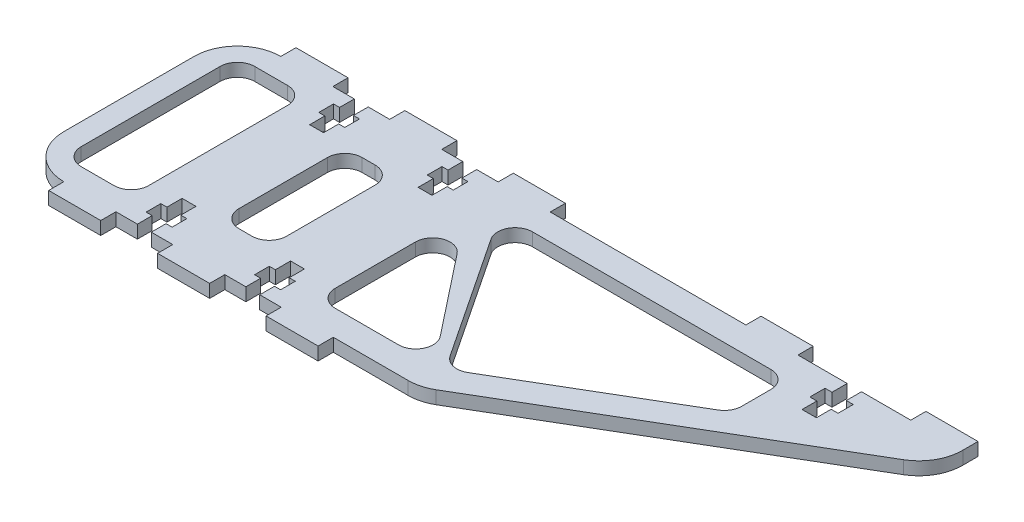
from build123d import *

# Parameters (mm, degrees)
EXTRUDE_1_DEPTH     = 3
FILLET_1_R          = 10
FILLET_2_R          = 10
SKETCH_2_W          = 11
SKETCH_2_H          = 28.4
SKETCH_2_W_2        = 15.55
SKETCH_2_H_2        = 40
CUT_EXTRUDE_1_DEPTH = 176.576963147
FILLET_3_R          = 4
EXTRUDE_START       = -3
EXTRUDE_2_DEPTH     = 3
FILLET_4_R          = 4


# Some blends are built 0.0001 mm under size
with BuildPart() as part:
    # 草图1 → 凸台-拉伸1 (new body)
    with BuildSketch(Plane(origin=(0, 0, 0), x_dir=(1, 0, 0), z_dir=(0, 1, 0))):
        Polygon((0, 0), (10, 0), (10, -3.5), (22, -3.5), (22, 0), (26.95, 0), (26.95, 3.4), (25.55, 3.4), (25.55, 6.8), (26.95, 6.8), (26.95, 10.3), (30.15, 10.3), (30.15, 6.8), (31.55, 6.8), (31.55, 3.4), (30.15, 3.4), (30.15, 0), (35.1, 0), (35.1, -3.5), (47.1, -3.5), (47.1, 0), (51.95, 0), (51.95, 3.4), (50.55, 3.4), (50.55, 6.8), (51.95, 6.8), (51.95, 10.3), (55.15, 10.3), (55.15, 6.8), (56.55, 6.8), (56.55, 3.4), (55.15, 3.4), (55.15, 0), (60.1, 0), (60.1, -3.5), (72.1, -3.5), (72.1, 0), (92.1, 0), (177.1, 50), (167.2, 50), (167.2, 53.5), (155.2, 53.5), (155.2, 50), (143.85, 50), (143.85, 46.5), (145.45, 46.5), (145.45, 43), (143.85, 43), (143.85, 39.6), (140.55, 39.6), (140.55, 43), (138.95, 43), (138.95, 46.5), (140.55, 46.5), (140.55, 50), (129.2, 50), (129.2, 53.5), (117.2, 53.5), (117.2, 50), (72.1, 50), (72.1, 53.5), (60.1, 53.5), (60.1, 50), (55.15, 50), (55.15, 46.6), (56.55, 46.6), (56.55, 43.2), (55.15, 43.2), (55.15, 39.7), (51.95, 39.7), (51.95, 43.2), (50.55, 43.2), (50.55, 46.6), (51.95, 46.6), (51.95, 50), (47.1, 50), (47.1, 53.5), (35.1, 53.5), (35.1, 50), (30.15, 50), (30.15, 46.6), (31.55, 46.6), (31.55, 43.2), (30.15, 43.2), (30.15, 39.7), (26.95, 39.7), (26.95, 43.2), (25.55, 43.2), (25.55, 46.6), (26.95, 46.6), (26.95, 50), (22, 50), (22, 53.5), (10, 53.5), (10, 50), (0, 50), align=None)
    extrude(amount=EXTRUDE_1_DEPTH)

    # 圆角1
    # the kernel refuses this fillet: 10 mm, written as the material it takes off along each edge
    with BuildSketch(Plane(origin=(177.1, -43.011578588, -50), x_dir=(-0.8619342151577696, 0, 0.5070201265633938), z_dir=(0, 1, 0))) as fillet_1_piece_1:
        with BuildLine():
            CenterArc((17.204631435, -10), FILLET_1_R, 90, 60.128922386)
            Line((8.53314873, -5.019499253), (8.359719076, -4.919889238))
            ThreePointArc((8.359719076, -4.919889238), (4.16517034, -2.68213647), (-0.101404025, -0.172386843))
            Line((-0.101404025, -0.172386843), (0, 0.2))
            Line((0, 0.2), (17.204631435, 0.2))
            Line((17.204631435, 0.2), (17.204631435, 0))
        make_face()
    extrude(amount=89.023157177, mode=Mode.SUBTRACT)

    # 圆角2
    fillet_2_edges = [part.edges().sort_by_distance(p)[0] for p in [
        (92.1, 1.5, 0),
        (0, 1.5, -50),
        (0, 1.5, 0),
    ]]
    fillet(fillet_2_edges, radius=FILLET_2_R - 0.0001)  # a hair under: the kernel refuses the full size

    # 草图2 → 切除-拉伸1 (cut, through all)
    with BuildSketch(Plane.XZ):
        Polygon((62.55, -6), (62.55, -44), (132.95, -44), (132.95, -30.990499855), (90.466150246, -6), align=None)
        with Locations((41.05, -25)):
            Rectangle(SKETCH_2_W, SKETCH_2_H)
        with Locations((12.775, -25)):
            Rectangle(SKETCH_2_W_2, SKETCH_2_H_2)
    extrude(amount=-CUT_EXTRUDE_1_DEPTH, mode=Mode.SUBTRACT)

    # 圆角3
    fillet_3_edges = [part.edges().sort_by_distance(p)[0] for p in [
        (62.55, 1.5, -6),
        (90.466150246, 1.5, -6),
        (132.95, 1.5, -30.990499855),
        (132.95, 1.5, -44),
        (62.55, 1.5, -44),
        (35.55, 1.5, -39.2),
        (35.55, 1.5, -10.8),
        (46.55, 1.5, -10.8),
        (46.55, 1.5, -39.2),
        (5, 1.5, -45),
        (5, 1.5, -5),
        (20.55, 1.5, -5),
        (20.55, 1.5, -45),
    ]]
    fillet(fillet_3_edges, radius=FILLET_3_R)

    # 草图3 → 凸台-拉伸2 (add)
    with BuildSketch(Plane.XZ.offset(EXTRUDE_START)):
        with BuildLine():
            Line((62.55, -40), (89.376917077, -6))
            ThreePointArc((89.376917077, -6), (90.427881528, -6.140534529), (91.404997583, -6.552263139))
            Line((91.404997583, -6.552263139), (66.55, -44))
            ThreePointArc((66.55, -44), (63.721572875, -42.828427125), (62.55, -40))
        make_face()
    extrude(amount=EXTRUDE_2_DEPTH)

    # 圆角4
    fillet_4_edges = [part.edges().sort_by_distance(p)[0] for p in [
        (91.404997583, 1.5, -6.552263139),
        (66.55, 1.5, -44),
        (89.376917077, 1.5, -6),
        (62.55, 1.5, -40),
    ]]
    fillet(fillet_4_edges, radius=FILLET_4_R)


solid = part.part
